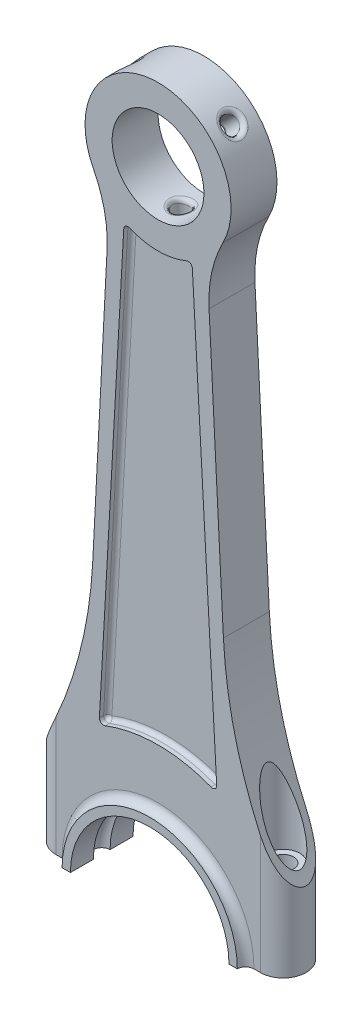
from build123d import *

# Parameters (mm, degrees)
SKETCH1_R               = 11
BOSS_EXTRUDE1_DEPTH     = 5.5
CUT_EXTRUDE1_DEPTH      = 2
SKETCH3_R               = 2.5
CUT_EXTRUDE3_DEPTH      = 176.175626158
CUT_EXTRUDE4_START      = -20
SKETCH4_R               = 4
CUT_EXTRUDE4_DEPTH      = 156.175626179
BOSS_EXTRUDE2_START     = 2
BOSS_EXTRUDE2_DEPTH     = 2
FILLET1_R               = 2
SKETCH7_R               = 2
CUT_EXTRUDE5_REACH      = 177.25
CUT_EXTRUDE5_END_RADIUS = 11
SKETCH8_R               = 2
FILLET2_R               = 1
FILLET3_R               = 1
FILLET4_START           = -1
FILLET4_DEPTH           = 173.5
FILLET5_START           = -1
FILLET5_DEPTH           = 173.5


with BuildPart() as part:
    # Sketch1 → Boss-Extrude1 (new, symmetric)
    with BuildSketch(Plane.XY):
        with BuildLine():
            Line((-12.223241788, 131.615339211), (-15.666149826, 64.997904456))
            ThreePointArc((-15.666149826, 64.997904456), (-19.947220954, 40.618798129), (-30, 18))
            Line((-30, 18), (-30, 0))
            Line((-30, 0), (-19, 0))
            ThreePointArc((-19, 0), (0, 19), (19, 0))
            Line((19, 0), (30, 0))
            Line((30, 0), (30, 18))
            ThreePointArc((30, 18), (19.947220954, 40.618798129), (15.666149826, 64.997904456))
            Line((15.666149826, 64.997904456), (12.223241788, 131.615339211))
            ThreePointArc((12.223241788, 131.615339211), (12.861330306, 139.506015231), (15.541199861, 146.955057061))
            ThreePointArc((15.541199861, 146.955057061), (0, 172.5), (-15.541199861, 146.955057061))
            ThreePointArc((-15.541199861, 146.955057061), (-12.861330306, 139.506015231), (-12.223241788, 131.615339211))
        make_face()
        with Locations((0, 155)):
            Circle(SKETCH1_R, mode=Mode.SUBTRACT)
    extrude(amount=BOSS_EXTRUDE1_DEPTH, both=True)

    # Sketch2 → Cut-Extrude1 (cut)
    with BuildSketch(Plane.XY.offset(5.5)):
        with BuildLine():
            Line((8.136141169, 139.506349466), (14.145010645, 32.014351061))
            ThreePointArc((14.145010645, 32.014351061), (0, 35), (-14.145010645, 32.014351061))
            Line((-14.145010645, 32.014351061), (-8.136141169, 139.506349466))
            ThreePointArc((-8.136141169, 139.506349466), (0, 137.5), (8.136141169, 139.506349466))
        make_face()
    cut_extrude1 = extrude(amount=-CUT_EXTRUDE1_DEPTH, mode=Mode.SUBTRACT)

    # Sketch3 → Cut-Extrude3 (cut, through all)
    with BuildSketch(Plane.XZ):
        with Locations((24.5, 0)):
            Circle(SKETCH3_R)
        with Locations((-24.5, 0)):
            Circle(SKETCH3_R)
    extrude(amount=-CUT_EXTRUDE3_DEPTH, mode=Mode.SUBTRACT)

    # Sketch4 → Cut-Extrude4 (cut, through all)
    with BuildSketch(Plane.XZ.offset(CUT_EXTRUDE4_START)):
        with Locations((-24.5, 0)):
            Circle(SKETCH4_R)
        with Locations((24.5, 0)):
            Circle(SKETCH4_R)
    extrude(amount=-CUT_EXTRUDE4_DEPTH, mode=Mode.SUBTRACT)

    # Sketch6 → Boss-Extrude2 (add)
    with BuildSketch(Plane.XY.offset(5.5).offset(BOSS_EXTRUDE2_START)):
        with BuildLine():
            Line((-19, 0), (-21, 0))
            ThreePointArc((-21, 0), (0, 21), (21, 0))
            Line((21, 0), (19, 0))
            ThreePointArc((19, 0), (0, 19), (-19, 0))
        make_face()
    boss_extrude2 = extrude(amount=-BOSS_EXTRUDE2_DEPTH)

    # Mirror1: Cut-Extrude1, Boss-Extrude2 across plane
    add(cut_extrude1.mirror(Plane.XY), mode=Mode.SUBTRACT)
    add(boss_extrude2.mirror(Plane.XY))

    # Fillet1
    fillet1_edges = [part.edges().sort_by_distance(p)[0] for p in [
        (0, 21, -5.5),
        (0, 21, 5.5),
    ]]
    fillet(fillet1_edges, radius=FILLET1_R - 0.0001)  # a hair under: the kernel refuses the full size

    # Sketch7 → Cut-Revolve1 (revolve, cut)
    with BuildSketch(Plane.XZ):
        with Locations((-19, 0)):
            Circle(SKETCH7_R)
    revolve(axis=Axis((0, 0, 0), (0, 0, 1)), mode=Mode.SUBTRACT)

    # Cut-Extrude5: up to this cylinder (the profile starts outside it)
    cut_extrude5_end = Plane(origin=(0, 155, 0), z_dir=(0, 0, -1)) * Cylinder(CUT_EXTRUDE5_END_RADIUS, 377.5, mode=Mode.PRIVATE)
    # Sketch8 → Cut-Extrude5 (cut, up to the surface)
    with BuildSketch(Plane.XZ, mode=Mode.PRIVATE) as cut_extrude5_sk1:
        Circle(SKETCH8_R)
    cut_extrude5_tool1 = extrude(cut_extrude5_sk1.sketch, amount=-CUT_EXTRUDE5_REACH, mode=Mode.PRIVATE) - cut_extrude5_end
    add(cut_extrude5_tool1.solids().sort_by_distance((0, 0, 0))[0], mode=Mode.SUBTRACT)

    # Sketch9 → Cut-Revolve2 (revolve, cut)
    with BuildSketch(Plane.XY, mode=Mode.PRIVATE) as cut_revolve2_sk:
        Polygon((-15.086077753, 170.086077753), (-3.24775093, 158.24775093), (-1.833537367, 159.661964492), (-13.671864191, 171.500291316), align=None)
    cut_revolve2 = revolve(cut_revolve2_sk.sketch.rotate(Axis((-15.086077753, 170.086077753, 0), (0.7071067811865486, -0.7071067811865466, 0)), 180), axis=Axis((-15.086077753, 170.086077753, 0), (0.7071067811865486, -0.7071067811865466, 0)), mode=Mode.SUBTRACT)

    # Mirror2: Cut-Revolve2 across plane
    add(cut_revolve2.mirror(Plane(origin=(0, 0, 0), x_dir=(0, 0, 1), z_dir=(1, 0, 0))), mode=Mode.SUBTRACT)

    # Fillet2
    fillet2_edges = [part.edges().sort_by_distance(p)[0] for p in [
        (-2.000000023, 144.183346176, 1e-09),
        (-6.23431569, 164.062742847, -1e-09),
        (-10.879077291, 168.707504416, 3e-09),
        (6.23431569, 164.062742847, -1e-09),
        (10.879077291, 168.707504416, 3e-09),
    ]]
    fillet(fillet2_edges, radius=FILLET2_R)

    # Fillet3
    fillet3_edges = [part.edges().sort_by_distance(p)[0] for p in [
        (0, 137.5, 3.5),
        (-8.136141169, 139.506349466, 4.5),
        (11.140575907, 85.760350263, 3.5),
        (8.136141169, 139.506349466, 4.5),
        (0, 35, 3.5),
        (14.145010645, 32.014351061, 4.5),
        (-11.140575907, 85.760350263, 3.5),
        (-14.145010645, 32.014351061, 4.5),
        (8.136141169, 139.506349466, -4.5),
        (-8.136141169, 139.506349466, -4.5),
        (-14.145010645, 32.014351061, -4.5),
        (14.145010645, 32.014351061, -4.5),
        (0, 137.5, -3.5),
        (-11.140575907, 85.760350263, -3.5),
        (0, 35, -3.5),
        (11.140575907, 85.760350263, -3.5),
    ]]
    fillet(fillet3_edges, radius=FILLET3_R)

    # Fillet4: read off the stored shape, not the designer's step
    # Fillet4 outline → Fillet4 (cut)
    with BuildSketch(Plane(origin=(0, 0, 0), x_dir=(1, 0, 0), z_dir=(0, 1, 0)).offset(FILLET4_START)):
        with BuildLine():
            ThreePointArc((-24.5, -5.5), (-28.389087297, -3.889087297), (-30, 0))
            Line((-30, 0), (-30, -5.5))
            Line((-30, -5.5), (-24.5, -5.5))
        make_face()
        with BuildLine():
            ThreePointArc((-30, 0), (-28.389087297, 3.889087297), (-24.5, 5.5))
            Line((-24.5, 5.5), (-30, 5.5))
            Line((-30, 5.5), (-30, 0))
        make_face()
    extrude(amount=FILLET4_DEPTH, mode=Mode.SUBTRACT)

    # Fillet5: read off the stored shape, not the designer's step
    # Fillet5 outline → Fillet5 (cut)
    with BuildSketch(Plane(origin=(0, 0, 0), x_dir=(1, 0, 0), z_dir=(0, 1, 0)).offset(FILLET5_START)):
        with BuildLine():
            ThreePointArc((24.5, 5.5), (28.389087297, 3.889087297), (30, 0))
            Line((30, 0), (30, 5.5))
            Line((30, 5.5), (24.5, 5.5))
        make_face()
        with BuildLine():
            ThreePointArc((30, 0), (28.389087297, -3.889087297), (24.5, -5.5))
            Line((24.5, -5.5), (30, -5.5))
            Line((30, -5.5), (30, 0))
        make_face()
    extrude(amount=FILLET5_DEPTH, mode=Mode.SUBTRACT)


solid = part.part
